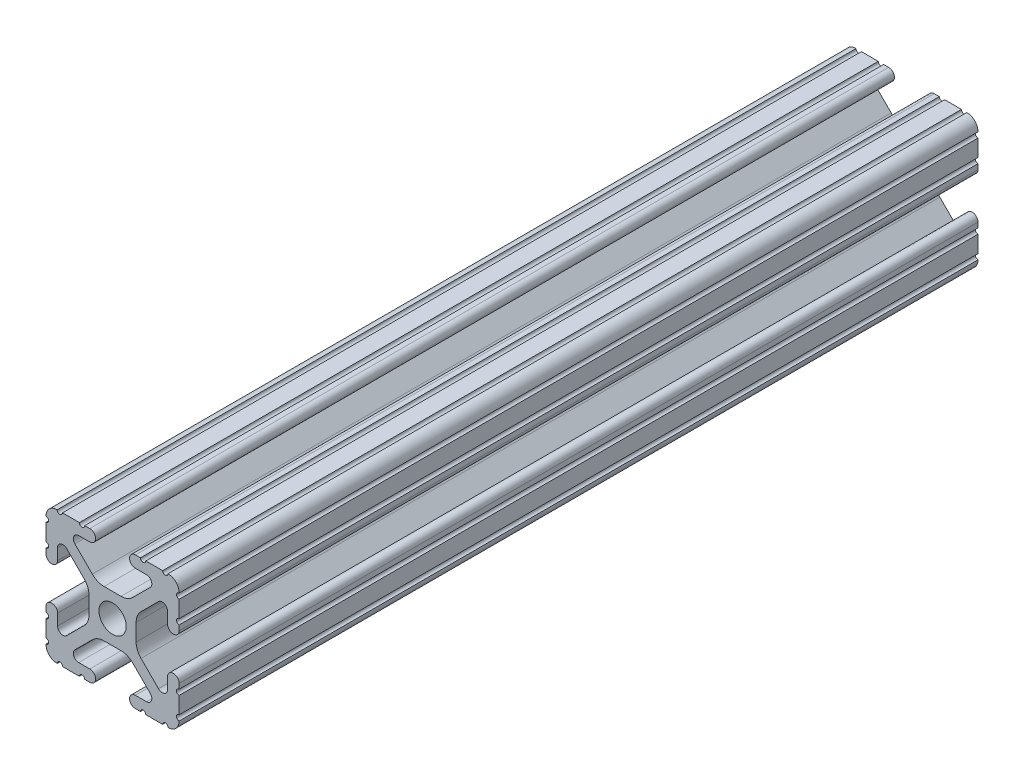
from build123d import *

# Parameters (mm, degrees)
SKETCH1_R           = 2.6035
BOSS_EXTRUDE1_DEPTH = 152.4


with BuildPart() as part:
    # Sketch1 → Boss-Extrude1 (new body)
    with BuildSketch(Plane(origin=(0, 0, -2463.8), x_dir=(-1, 0, 0), z_dir=(0, 0, -1))):
        with BuildLine():
            Line((12.7, -9.5504), (12.7, -6.3330836))
            ThreePointArc((12.7, -6.3330836), (12.192, -5.8250836), (12.7, -5.3170836))
            Line((12.7, -5.3170836), (12.7, -4.3434))
            ThreePointArc((12.7, -4.3434), (11.5951, -3.2385), (10.4902, -4.3434))
            Line((10.4902, -4.3434), (10.4902, -6.474794456))
            ThreePointArc((10.4902, -6.474794456), (9.863006367, -7.413456061), (8.75577951, -7.193214945))
            Line((8.75577951, -7.193214945), (5.42573597, -3.863171405))
            ThreePointArc((5.42573597, -3.863171405), (4.737482484, -2.833127272), (4.4958, -1.618107374))
            Line((4.4958, -1.618107374), (4.4958, 1.618107374))
            ThreePointArc((4.4958, 1.618107374), (4.737482484, 2.833127272), (5.42573597, 3.863171405))
            Line((5.42573597, 3.863171405), (8.75577951, 7.193214945))
            ThreePointArc((8.75577951, 7.193214945), (9.863006367, 7.413456061), (10.4902, 6.474794456))
            Line((10.4902, 6.474794456), (10.4902, 4.343399971))
            ThreePointArc((10.4902, 4.343399971), (11.5951, 3.238499971), (12.7, 4.343399971))
            Line((12.7, 4.343399971), (12.7, 5.3170836))
            ThreePointArc((12.7, 5.3170836), (12.192, 5.8250836), (12.7, 6.3330836))
            Line((12.7, 6.3330836), (12.7, 9.5504))
            ThreePointArc((12.7, 9.5504), (12.192000006, 10.058323491), (12.699846982, 10.566399977))
            ThreePointArc((12.699846982, 10.566399977), (12.082522516, 12.082522516), (10.566399977, 12.699846982))
            ThreePointArc((10.566399977, 12.699846982), (10.058323491, 12.192000006), (9.5504, 12.7))
            Line((9.5504, 12.7), (6.3330836, 12.7))
            ThreePointArc((6.3330836, 12.7), (5.8250836, 12.192), (5.3170836, 12.7))
            Line((5.3170836, 12.7), (4.3434, 12.7))
            ThreePointArc((4.3434, 12.7), (3.2385, 11.5951), (4.3434, 10.4902))
            Line((4.3434, 10.4902), (6.474794456, 10.4902))
            ThreePointArc((6.474794456, 10.4902), (7.413456061, 9.863006367), (7.193214945, 8.75577951))
            Line((7.193214945, 8.75577951), (3.863171405, 5.42573597))
            ThreePointArc((3.863171405, 5.42573597), (2.833127272, 4.737482484), (1.618107374, 4.4958))
            Line((1.618107374, 4.4958), (-1.618107374, 4.4958))
            ThreePointArc((-1.618107374, 4.4958), (-2.833127272, 4.737482484), (-3.863171405, 5.42573597))
            Line((-3.863171405, 5.42573597), (-7.193214945, 8.75577951))
            ThreePointArc((-7.193214945, 8.75577951), (-7.413456061, 9.863006367), (-6.474794456, 10.4902))
            Line((-6.474794456, 10.4902), (-4.343399971, 10.4902))
            ThreePointArc((-4.343399971, 10.4902), (-3.238499971, 11.5951), (-4.343399971, 12.7))
            Line((-4.343399971, 12.7), (-5.3170836, 12.7))
            ThreePointArc((-5.3170836, 12.7), (-5.8250836, 12.192), (-6.3330836, 12.7))
            Line((-6.3330836, 12.7), (-9.5504, 12.7))
            ThreePointArc((-9.5504, 12.7), (-10.058323491, 12.192000006), (-10.566399977, 12.699846982))
            ThreePointArc((-10.566399977, 12.699846982), (-12.082522516, 12.082522516), (-12.699846982, 10.566399977))
            ThreePointArc((-12.699846982, 10.566399977), (-12.192000006, 10.058323491), (-12.7, 9.5504))
            Line((-12.7, 9.5504), (-12.7, 6.3330836))
            ThreePointArc((-12.7, 6.3330836), (-12.192, 5.8250836), (-12.7, 5.3170836))
            Line((-12.7, 5.3170836), (-12.7, 4.3434))
            ThreePointArc((-12.7, 4.3434), (-11.5951, 3.2385), (-10.4902, 4.3434))
            Line((-10.4902, 4.3434), (-10.4902, 6.474794456))
            ThreePointArc((-10.4902, 6.474794456), (-9.863006367, 7.413456061), (-8.75577951, 7.193214945))
            Line((-8.75577951, 7.193214945), (-5.42573597, 3.863171405))
            ThreePointArc((-5.42573597, 3.863171405), (-4.737482484, 2.833127272), (-4.4958, 1.618107374))
            Line((-4.4958, 1.618107374), (-4.4958, -1.618107374))
            ThreePointArc((-4.4958, -1.618107374), (-4.737482484, -2.833127272), (-5.42573597, -3.863171405))
            Line((-5.42573597, -3.863171405), (-8.75577951, -7.193214945))
            ThreePointArc((-8.75577951, -7.193214945), (-9.863006367, -7.413456061), (-10.4902, -6.474794456))
            Line((-10.4902, -6.474794456), (-10.4902, -4.343399971))
            ThreePointArc((-10.4902, -4.343399971), (-11.5951, -3.238499971), (-12.7, -4.343399971))
            Line((-12.7, -4.343399971), (-12.7, -5.3170836))
            ThreePointArc((-12.7, -5.3170836), (-12.192, -5.8250836), (-12.7, -6.3330836))
            Line((-12.7, -6.3330836), (-12.7, -9.5504))
            ThreePointArc((-12.7, -9.5504), (-12.192000006, -10.058323491), (-12.699846982, -10.566399977))
            ThreePointArc((-12.699846982, -10.566399977), (-12.082522516, -12.082522516), (-10.566399977, -12.699846982))
            ThreePointArc((-10.566399977, -12.699846982), (-10.058323491, -12.192000006), (-9.5504, -12.7))
            Line((-9.5504, -12.7), (-6.3330836, -12.7))
            ThreePointArc((-6.3330836, -12.7), (-5.8250836, -12.192), (-5.3170836, -12.7))
            Line((-5.3170836, -12.7), (-4.3434, -12.7))
            ThreePointArc((-4.3434, -12.7), (-3.2385, -11.5951), (-4.3434, -10.4902))
            Line((-4.3434, -10.4902), (-6.474794456, -10.4902))
            ThreePointArc((-6.474794456, -10.4902), (-7.413456061, -9.863006367), (-7.193214945, -8.75577951))
            Line((-7.193214945, -8.75577951), (-3.863171405, -5.42573597))
            ThreePointArc((-3.863171405, -5.42573597), (-2.833127272, -4.737482484), (-1.618107374, -4.4958))
            Line((-1.618107374, -4.4958), (1.618107374, -4.4958))
            ThreePointArc((1.618107374, -4.4958), (2.833127272, -4.737482484), (3.863171405, -5.42573597))
            Line((3.863171405, -5.42573597), (7.193214945, -8.75577951))
            ThreePointArc((7.193214945, -8.75577951), (7.413456061, -9.863006367), (6.474794456, -10.4902))
            Line((6.474794456, -10.4902), (4.343399971, -10.4902))
            ThreePointArc((4.343399971, -10.4902), (3.238499971, -11.5951), (4.343399971, -12.7))
            Line((4.343399971, -12.7), (5.3170836, -12.7))
            ThreePointArc((5.3170836, -12.7), (5.8250836, -12.192), (6.3330836, -12.7))
            Line((6.3330836, -12.7), (9.5504, -12.7))
            ThreePointArc((9.5504, -12.7), (10.058323491, -12.192000006), (10.566399977, -12.699846982))
            ThreePointArc((10.566399977, -12.699846982), (12.082522516, -12.082522516), (12.699846982, -10.566399977))
            ThreePointArc((12.699846982, -10.566399977), (12.192000006, -10.058323491), (12.7, -9.5504))
        make_face()
        Circle(SKETCH1_R, mode=Mode.SUBTRACT)
    extrude(amount=BOSS_EXTRUDE1_DEPTH)


solid = part.part
